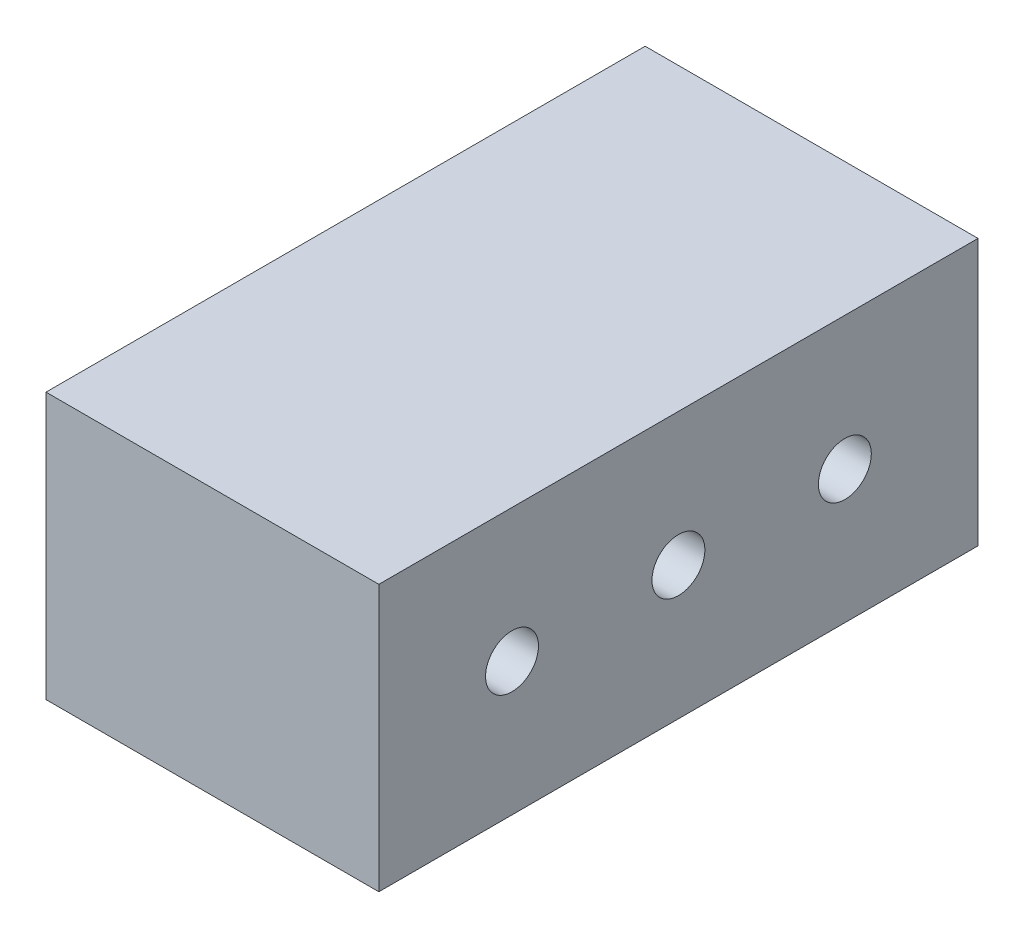
from build123d import *

# Parameters (mm, degrees)
SKETCH1_W              = 25.4
SKETCH1_H              = 45.72
BOSS_EXTRUDE1_DEPTH    = 20.32
F_10_32_TAPPED_HOLE1_D = 4.0386


with BuildPart() as part:
    # Sketch1 → Boss-Extrude1 (new body)
    with BuildSketch(Plane(origin=(0, 0, 0), x_dir=(1, 0, 0), z_dir=(0, 1, 0))):
        Rectangle(SKETCH1_W, SKETCH1_H)
    extrude(amount=BOSS_EXTRUDE1_DEPTH)

    # #10-32 Tapped Hole1 (through all)
    with Locations(Plane(origin=(12.7, 0, 0), x_dir=(0, 0, -1), z_dir=(1, 0, 0))):
        with Locations((-12.7, 10.16), (0, 10.16), (12.7, 10.16)):
            Hole(F_10_32_TAPPED_HOLE1_D / 2)


solid = part.part
